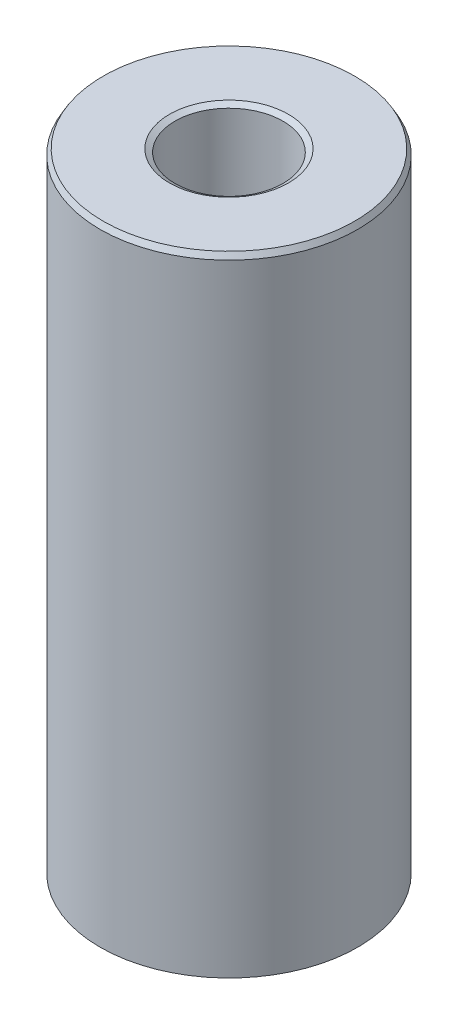
from build123d import *
from OCP.BRepFilletAPI import BRepFilletAPI_MakeChamfer

# Parameters (mm, degrees)
SKETCH1_R           = 47.5
BOSS_EXTRUDE1_DEPTH = 232.264597678
SKETCH2_R           = 19.909642402
CUT_EXTRUDE1_DEPTH  = 242.783670529
CHAMFER1_SIZE       = 2.023692278
CHAMFER1_SIZE2      = 1.168379281


with BuildPart() as part:
    # Sketch1 → Boss-Extrude1 (new body)
    with BuildSketch(Plane(origin=(0, 0, 0), x_dir=(1, 0, 0), z_dir=(0, 1, 0))):
        Circle(SKETCH1_R)
    extrude(amount=BOSS_EXTRUDE1_DEPTH)

    # Sketch2 → Cut-Extrude1 (cut, through all)
    with BuildSketch(Plane(origin=(0, 0, 0), x_dir=(1, 0, 0), z_dir=(0, 1, 0))):
        Circle(SKETCH2_R)
    extrude(amount=CUT_EXTRUDE1_DEPTH, mode=Mode.SUBTRACT)

    # Chamfer1: one chamfer whose edges measure the first distance from different faces: ONE call of the kernel's chamfer builder (chamfer() names one face for all edges)
    chamfer1_edges_1 = [part.edges().sort_by_distance(p)[0] for p in [
        (-19.909642402, 232.264597678, 0),
    ]]
    chamfer1_side_1 = [part.faces().sort_by_distance(p)[0] for p in [
        (-46.156497116, 232.264597678, 0),
    ]]
    chamfer1_edges_2 = [part.edges().sort_by_distance(p)[0] for p in [
        (-19.909642402, 0, 0),
    ]]
    chamfer1_side_2 = [part.faces().sort_by_distance(p)[0] for p in [
        (-19.909642402, 116.132298839, 0),
    ]]
    chamfer1_edges_3 = [part.edges().sort_by_distance(p)[0] for p in [
        (-47.5, 0, 0),
    ]]
    chamfer1_side_3 = [part.faces().sort_by_distance(p)[0] for p in [
        (-46.156497116, 0, 0),
    ]]
    chamfer1_edges_4 = [part.edges().sort_by_distance(p)[0] for p in [
        (-47.5, 232.264597678, 0),
    ]]
    chamfer1_side_4 = [part.faces().sort_by_distance(p)[0] for p in [
        (-47.5, 116.132298839, 0),
    ]]
    chamfer1 = BRepFilletAPI_MakeChamfer(part.part.solid().wrapped)
    for e in chamfer1_edges_1:
        chamfer1.Add(CHAMFER1_SIZE, CHAMFER1_SIZE2, e.wrapped, chamfer1_side_1[0].wrapped)  # the first distance lies on this face
    for e in chamfer1_edges_2:
        chamfer1.Add(CHAMFER1_SIZE, CHAMFER1_SIZE2, e.wrapped, chamfer1_side_2[0].wrapped)  # the first distance lies on this face
    for e in chamfer1_edges_3:
        chamfer1.Add(CHAMFER1_SIZE, CHAMFER1_SIZE2, e.wrapped, chamfer1_side_3[0].wrapped)  # the first distance lies on this face
    for e in chamfer1_edges_4:
        chamfer1.Add(CHAMFER1_SIZE, CHAMFER1_SIZE2, e.wrapped, chamfer1_side_4[0].wrapped)  # the first distance lies on this face
    add(Compound.cast(chamfer1.Shape()), mode=Mode.REPLACE)


solid = part.part
